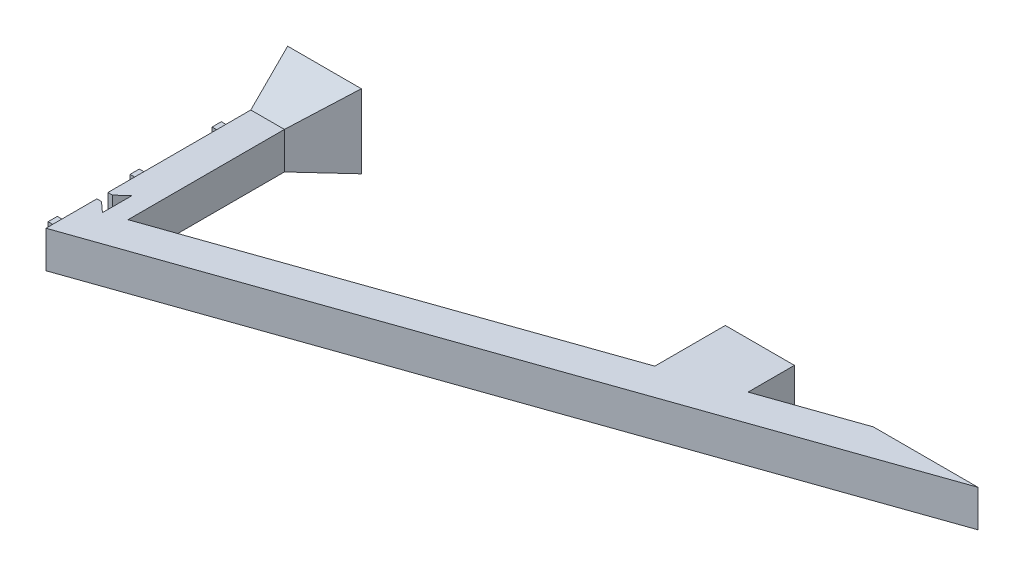
from build123d import *

# Parameters (mm, degrees)
P_IDAT_VYSUNUT_M1_DEPTH  = 8
ODEBRAT_VYSUNUT_M1_DEPTH = 4.4
SKICA3_W                 = 2
SKICA3_H                 = 2
P_IDAT_VYSUNUT_M2_DEPTH  = 4
P_IDAT_START             = 8
SKICA5_W                 = 16
SKICA5_H                 = 8
P_IDAT_VYSUNUT_M4_DEPTH  = 16
ODEBRAT_VYSUNUT_M2_DEPTH = 161.57934176
ODEBRAT_VYSUNUT_M3_DEPTH = 161.57934176


with BuildPart() as part:
    # Skica1 → Přidat vysunutím1 (new body)
    with BuildSketch(Plane(origin=(0, 0, 0), x_dir=(1, 0, 0), z_dir=(0, 1, 0))):
        Polygon((0, 0), (0, -55.45), (149.85, -3), (127.147799643, -3), (107, -10.052066008), (107, 0), (92, 0), (92, -15.302316258), (7.3, -44.948729338), (7.3, 0), align=None)
    extrude(amount=P_IDAT_VYSUNUT_M1_DEPTH)

    # Skica2 → Odebrat vysunutím1 (cut)
    with BuildSketch(Plane(origin=(0, 8, 0), x_dir=(1, 0, 0), z_dir=(0, 1, 0))):
        Polygon((0, -42), (1, -42), (3.2, -40), (3.2, -46.4), (1, -44.4), (0, -44.4), align=None)
    extrude(amount=-ODEBRAT_VYSUNUT_M1_DEPTH, mode=Mode.SUBTRACT)

    # Skica3 → Přidat vysunutím2 (add)
    with BuildSketch(Plane.ZY):
        with Locations((14.4, 4)):
            Rectangle(SKICA3_W, SKICA3_H)
        with Locations((32.2, 4)):
            Rectangle(SKICA3_W, SKICA3_H)
        with Locations((50, 4)):
            Rectangle(SKICA3_W, SKICA3_H)
    extrude(amount=P_IDAT_VYSUNUT_M2_DEPTH)

    # Skica5 → Přidat vysunutím4 (add)
    with BuildSketch(Plane(origin=(0, 8, 0), x_dir=(1, 0, 0), z_dir=(0, 1, 0)).offset(P_IDAT_START)):
        with Locations((8, -7)):
            Rectangle(SKICA5_W, SKICA5_H)
    extrude(amount=-P_IDAT_VYSUNUT_M4_DEPTH)

    # Skica6 → Odebrat vysunutím2 (cut, through all)
    with BuildSketch(Plane.ZY):
        Polygon((3, 16), (11, 16), (11, 8), align=None)
    extrude(amount=-ODEBRAT_VYSUNUT_M2_DEPTH, mode=Mode.SUBTRACT)

    # Skica7 → Odebrat vysunutím3 (cut, through all)
    with BuildSketch(Plane.XZ):
        Polygon((7.3, 11), (16, 11), (16, 3), align=None)
    extrude(amount=-ODEBRAT_VYSUNUT_M3_DEPTH, mode=Mode.SUBTRACT)


solid = part.part
